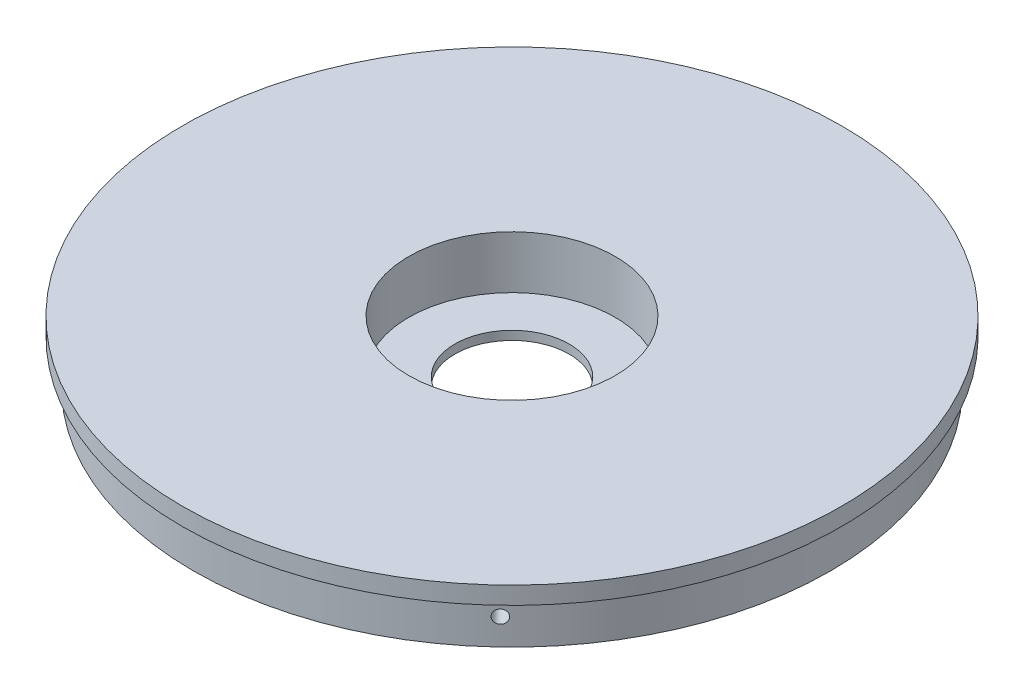
from build123d import *

# Parameters (mm, degrees)
SZKIC4_R                    = 75
DODANIE_WYCI_GNI_CIE2_DEPTH = 14
SZKIC5_R                    = 23.5
WYTNIJ_WYCI_GNI_CIE3_DEPTH  = 12
SZKIC6_R                    = 13
WYTNIJ_WYCI_GNI_CIE4_DEPTH  = 12
SZKIC7_R                    = 75
SZKIC7_R_2                  = 72.5
WYTNIJ_WYCI_GNI_CIE5_DEPTH  = 10
SZKIC8_R                    = 1.5
WYTNIJ_WYCI_GNI_CIE6_DEPTH  = 6
SZKIC10_R                   = 1.5
WYTNIJ_WYCI_GNI_CIE7_DEPTH  = 6
SZYK_KO_OWY1_COUNT          = 4


with BuildPart() as part:
    # Szkic4 → Dodanie-wyciągnięcie2 (new body)
    with BuildSketch(Plane(origin=(0, 0, 0), x_dir=(1, 0, 0), z_dir=(0, 1, 0))):
        Circle(SZKIC4_R)
    extrude(amount=DODANIE_WYCI_GNI_CIE2_DEPTH)

    # Szkic5 → Wytnij-wyciągnięcie3 (cut)
    with BuildSketch(Plane(origin=(0, 14, 0), x_dir=(1, 0, 0), z_dir=(0, 1, 0))):
        Circle(SZKIC5_R)
    extrude(amount=-WYTNIJ_WYCI_GNI_CIE3_DEPTH, mode=Mode.SUBTRACT)

    # Szkic6 → Wytnij-wyciągnięcie4 (cut)
    with BuildSketch(Plane(origin=(0, 2, 0), x_dir=(1, 0, 0), z_dir=(0, 1, 0))):
        Circle(SZKIC6_R)
    extrude(amount=-WYTNIJ_WYCI_GNI_CIE4_DEPTH, mode=Mode.SUBTRACT)

    # Szkic7 → Wytnij-wyciągnięcie5 (cut)
    with BuildSketch(Plane.XZ):
        Circle(SZKIC7_R)
        Circle(SZKIC7_R_2, mode=Mode.SUBTRACT)
    extrude(amount=-WYTNIJ_WYCI_GNI_CIE5_DEPTH, mode=Mode.SUBTRACT)

    # Szkic8 → Wytnij-wyciągnięcie6 (cut)
    with BuildSketch(Plane(origin=(0, 0, 0), x_dir=(-1, 0, 0), z_dir=(0, -1, 0))):
        with Locations((21.899811953, -20.795149348)):
            Circle(SZKIC8_R)
        with Locations((-27.411022908, 26.028365741)):
            Circle(SZKIC8_R)
    extrude(amount=-WYTNIJ_WYCI_GNI_CIE6_DEPTH, mode=Mode.SUBTRACT)

    # Szkic10 → Wytnij-wyciągnięcie7 (cut)
    with BuildSketch(Plane(origin=(52.574051874, 0, -49.922130058), x_dir=(0.6885811042499866, 0, 0.7251593361943769), z_dir=(-0.7251593361943769, 0, 0.6885811042499866))):
        with Locations((0, 6)):
            Circle(SZKIC10_R)
    wytnij_wyci_gni_cie7 = extrude(amount=WYTNIJ_WYCI_GNI_CIE7_DEPTH, mode=Mode.SUBTRACT)

    # Szyk kołowy1: Wytnij-wyciągnięcie7 ×4 about axis
    szyk_ko_owy1_axis = Axis((0, 10, 0), (0, -1, 0))
    for i in range(1, SZYK_KO_OWY1_COUNT):
        add(wytnij_wyci_gni_cie7.rotate(szyk_ko_owy1_axis, i * 360 / SZYK_KO_OWY1_COUNT), mode=Mode.SUBTRACT)


solid = part.part
